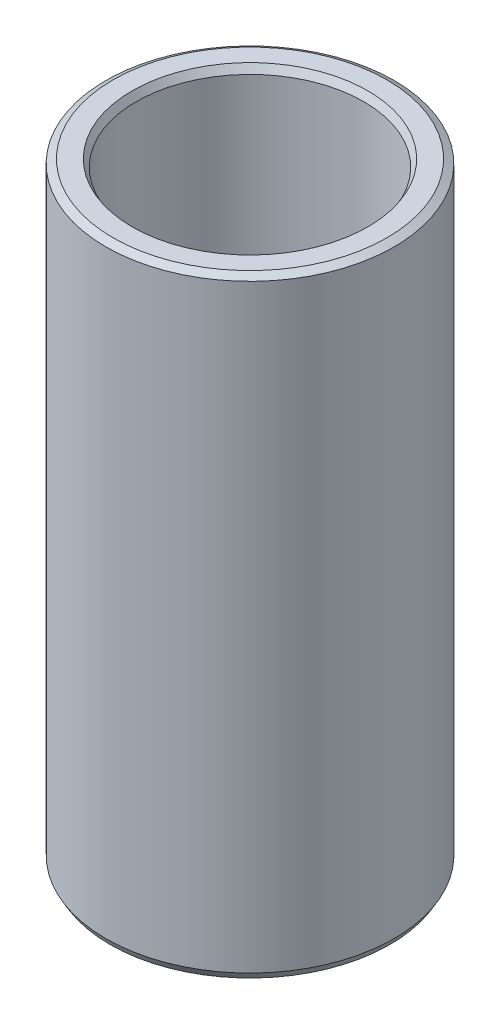
from build123d import *
from OCP.BRepFilletAPI import BRepFilletAPI_MakeChamfer

# Parameters (mm, degrees)
SKETCH1_R           = 50
BOSS_EXTRUDE1_DEPTH = 211.772217321
SKETCH2_R           = 39.433676203
CUT_EXTRUDE1_DEPTH  = 224.265474333
CHAMFER1_SIZE       = 1.453803604
CHAMFER1_SIZE2      = 2.518061706


with BuildPart() as part:
    # Sketch1 → Boss-Extrude1 (new body)
    with BuildSketch(Plane(origin=(0, 0, 0), x_dir=(1, 0, 0), z_dir=(0, 1, 0))):
        Circle(SKETCH1_R)
    extrude(amount=BOSS_EXTRUDE1_DEPTH)

    # Sketch2 → Cut-Extrude1 (cut, through all)
    with BuildSketch(Plane(origin=(0, 0, 0), x_dir=(1, 0, 0), z_dir=(0, 1, 0))):
        Circle(SKETCH2_R)
    extrude(amount=CUT_EXTRUDE1_DEPTH, mode=Mode.SUBTRACT)

    # Chamfer1: one chamfer whose edges measure the first distance from different faces: ONE call of the kernel's chamfer builder (chamfer() names one face for all edges)
    chamfer1_edges_1 = [part.edges().sort_by_distance(p)[0] for p in [
        (-39.433676203, 211.772217321, 0),
    ]]
    chamfer1_side_1 = [part.faces().sort_by_distance(p)[0] for p in [
        (-48.585786438, 211.772217321, 0),
    ]]
    chamfer1_edges_2 = [part.edges().sort_by_distance(p)[0] for p in [
        (-39.433676203, 0, 0),
    ]]
    chamfer1_side_2 = [part.faces().sort_by_distance(p)[0] for p in [
        (-39.433676203, 105.886108661, 0),
    ]]
    chamfer1_edges_3 = [part.edges().sort_by_distance(p)[0] for p in [
        (-50, 0, 0),
    ]]
    chamfer1_side_3 = [part.faces().sort_by_distance(p)[0] for p in [
        (-48.585786438, 0, 0),
    ]]
    chamfer1_edges_4 = [part.edges().sort_by_distance(p)[0] for p in [
        (-50, 211.772217321, 0),
    ]]
    chamfer1_side_4 = [part.faces().sort_by_distance(p)[0] for p in [
        (-50, 105.886108661, 0),
    ]]
    chamfer1 = BRepFilletAPI_MakeChamfer(part.part.solid().wrapped)
    for e in chamfer1_edges_1:
        chamfer1.Add(CHAMFER1_SIZE, CHAMFER1_SIZE2, e.wrapped, chamfer1_side_1[0].wrapped)  # the first distance lies on this face
    for e in chamfer1_edges_2:
        chamfer1.Add(CHAMFER1_SIZE, CHAMFER1_SIZE2, e.wrapped, chamfer1_side_2[0].wrapped)  # the first distance lies on this face
    for e in chamfer1_edges_3:
        chamfer1.Add(CHAMFER1_SIZE, CHAMFER1_SIZE2, e.wrapped, chamfer1_side_3[0].wrapped)  # the first distance lies on this face
    for e in chamfer1_edges_4:
        chamfer1.Add(CHAMFER1_SIZE, CHAMFER1_SIZE2, e.wrapped, chamfer1_side_4[0].wrapped)  # the first distance lies on this face
    add(Compound.cast(chamfer1.Shape()), mode=Mode.REPLACE)


solid = part.part
